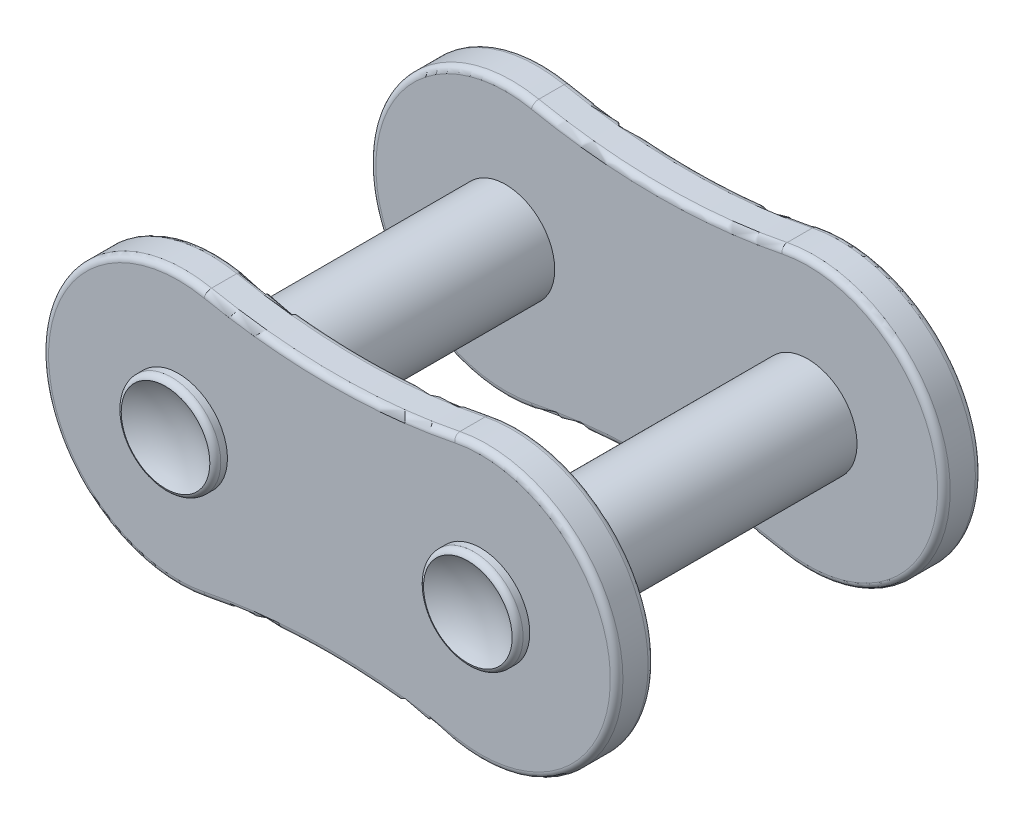
from build123d import *

# Parameters (mm, degrees)
SKETCH1_R           = 1.95
BOSS_EXTRUDE1_DEPTH = 1.5
BOSS_EXTRUDE2_START = -0.508
SKETCH2_R           = 1.95
BOSS_EXTRUDE2_DEPTH = 15.508
FILLET1_R           = 0.25
FILLET2_R           = 0.25
SCALE1_SCALE        = 0.5


with BuildPart() as part:
    # Sketch1 → Boss-Extrude1 (new body)
    with BuildSketch(Plane.XY):
        with BuildLine():
            ThreePointArc((-4.928420143, 5.292609622), (-11.4, 0), (-4.928420143, -5.292609622))
            ThreePointArc((-4.928420143, -5.292609622), (0, -4.798698786), (4.928420143, -5.292609622))
            ThreePointArc((4.928420143, -5.292609622), (11.4, 0), (4.928420143, 5.292609622))
            ThreePointArc((4.928420143, 5.292609622), (0, 4.798698786), (-4.928420143, 5.292609622))
        make_face()
        with Locations((-6, 0)):
            Circle(SKETCH1_R, mode=Mode.SUBTRACT)
        with Locations(Location((6, 0, 0), (0, 0, 180))):
            Circle(SKETCH1_R, mode=Mode.SUBTRACT)
    boss_extrude1 = extrude(amount=BOSS_EXTRUDE1_DEPTH)

    # Sketch2 → Boss-Extrude2 (add)
    with BuildSketch(Plane.XY.offset(BOSS_EXTRUDE2_START)):
        with Locations((-6, 0)):
            Circle(SKETCH2_R)
    boss_extrude2 = extrude(amount=BOSS_EXTRUDE2_DEPTH)

    # Mirror1: Boss-Extrude1 across plane
    add(boss_extrude1.mirror(Plane.XY.offset(7.246)))

    # Sketch3 → Cut-Revolve3 (revolve, cut)
    with BuildSketch(Plane(origin=(0, 0, 0), x_dir=(1, 0, 0), z_dir=(0, 1, 0)), mode=Mode.PRIVATE) as cut_revolve3_sk:
        with BuildLine():
            Line((-7.759186175, -15), (-6, -15))
            Line((-6, -15), (-6, -14.492))
            ThreePointArc((-6, -14.492), (-6.915532632, -14.62154262), (-7.759186175, -15))
        make_face()
    cut_revolve3 = revolve(cut_revolve3_sk.sketch.rotate(Axis((-6, 0, 14.492), (0, 0, 1)), 180), axis=Axis((-6, 0, 14.492), (0, 0, 1)), mode=Mode.SUBTRACT)

    # Mirror4: Cut-Revolve3 across plane
    add(cut_revolve3.mirror(Plane.XY.offset(7.246)), mode=Mode.SUBTRACT)

    # Mirror2: Boss-Extrude2, Cut-Revolve3 across plane
    add(boss_extrude2.mirror(Plane(origin=(0, 0, 0), x_dir=(0, 0, 1), z_dir=(1, 0, 0))))
    add(cut_revolve3.mirror(Plane(origin=(0, 0, 0), x_dir=(0, 0, 1), z_dir=(1, 0, 0))), mode=Mode.SUBTRACT)

    # Mirror2 copy 1 sketch → Mirror2 copy 1 (revolve, cut)
    with BuildSketch(Plane(origin=(0, 0, 14.492), x_dir=(-1, 0, 0), z_dir=(0, 1, 0))):
        with BuildLine():
            Line((-7.759186175, -15), (-6, -15))
            Line((-6, -15), (-6, -14.492))
            ThreePointArc((-6, -14.492), (-6.915532632, -14.62154262), (-7.759186175, -15))
        make_face()
    revolve(axis=Axis((6, 0, 0), (0, 0, -1)), mode=Mode.SUBTRACT)

    # Fillet1
    fillet1_edges = [part.edges().sort_by_distance(p)[0] for p in [
        (0, -4.798698786, 1.5),
        (11.4, 0, 1.5),
        (0, 4.798698786, 12.992),
        (11.4, 0, 12.992),
        (0, -4.798698786, 12.992),
        (-11.4, 0, 12.992),
        (0, 4.798698786, 14.492),
        (-11.4, 0, 14.492),
        (0, -4.798698786, 14.492),
        (11.4, 0, 14.492),
        (0, 4.798698786, 1.5),
        (11.4, 0, 0),
        (0, -4.798698786, 0),
        (-11.4, 0, 0),
        (0, 4.798698786, 0),
        (-11.4, 0, 1.5),
    ]]
    fillet(fillet1_edges, radius=FILLET1_R)

    # Fillet2
    # the kernel refuses this fillet: 0.25 mm, written as the material it takes off along each edge
    with BuildSketch(Plane(origin=(-6, 0, -0.508), x_dir=(1, 0, 0), z_dir=(0, -1, 0))) as fillet2_piece_1:
        with BuildLine():
            CenterArc((1.7, 0.242892974), FILLET2_R, 283.694489324, 76.305510676)
            Line((1.759186175, 0), (1.760369899, -0.004857859))
            ThreePointArc((1.760369899, -0.004857859), (1.854593088, -0.005), (1.95, -0.005))
            Line((1.95, -0.005), (1.955, 0))
            Line((1.955, 0), (1.955, 0.242892974))
            Line((1.955, 0.242892974), (1.95, 0.242892974))
        make_face()
    revolve(axis=Axis((-6, 0, -0.508), (0, 0, 1)), mode=Mode.SUBTRACT)
    with BuildSketch(Plane(origin=(-6, 0, 15), x_dir=(1, 0, 0), z_dir=(0, -1, 0))) as fillet2_piece_2:
        with BuildLine():
            CenterArc((1.7, -0.242892974), FILLET2_R, 0, 76.305510676)
            Line((1.759186175, 0), (1.760369899, 0.004857859))
            ThreePointArc((1.760369899, 0.004857859), (1.854593088, 0.005), (1.95, 0.005))
            Line((1.95, 0.005), (1.955, 0))
            Line((1.955, 0), (1.955, -0.242892974))
            Line((1.955, -0.242892974), (1.95, -0.242892974))
        make_face()
    revolve(axis=Axis((-6, 0, 15), (0, 0, 1)), mode=Mode.SUBTRACT)
    with BuildSketch(Plane(origin=(6, 0, 15), x_dir=(-1, 0, 0), z_dir=(0, -1, 0))) as fillet2_piece_3:
        with BuildLine():
            CenterArc((1.7, 0.242892974), FILLET2_R, 283.694489324, 76.305510676)
            Line((1.759186175, 0), (1.760369899, -0.004857859))
            ThreePointArc((1.760369899, -0.004857859), (1.854593088, -0.005), (1.95, -0.005))
            Line((1.95, -0.005), (1.955, 0))
            Line((1.955, 0), (1.955, 0.242892974))
            Line((1.955, 0.242892974), (1.95, 0.242892974))
        make_face()
    revolve(axis=Axis((6, 0, 15), (0, 0, -1)), mode=Mode.SUBTRACT)
    with BuildSketch(Plane(origin=(6, 0, -0.508), x_dir=(-1, 0, 0), z_dir=(0, -1, 0))) as fillet2_piece_4:
        with BuildLine():
            CenterArc((1.7, -0.242892974), FILLET2_R, 0, 76.305510676)
            Line((1.759186175, 0), (1.760369899, 0.004857859))
            ThreePointArc((1.760369899, 0.004857859), (1.854593088, 0.005), (1.95, 0.005))
            Line((1.95, 0.005), (1.955, 0))
            Line((1.955, 0), (1.955, -0.242892974))
            Line((1.955, -0.242892974), (1.95, -0.242892974))
        make_face()
    revolve(axis=Axis((6, 0, -0.508), (0, 0, -1)), mode=Mode.SUBTRACT)


with BuildPart() as part_1:
    # Scale1: scaled about (0, 0, 7.246)
    add(part.part.scale(SCALE1_SCALE).moved(Location((0, 0, 3.623))))


solid = part_1.part
